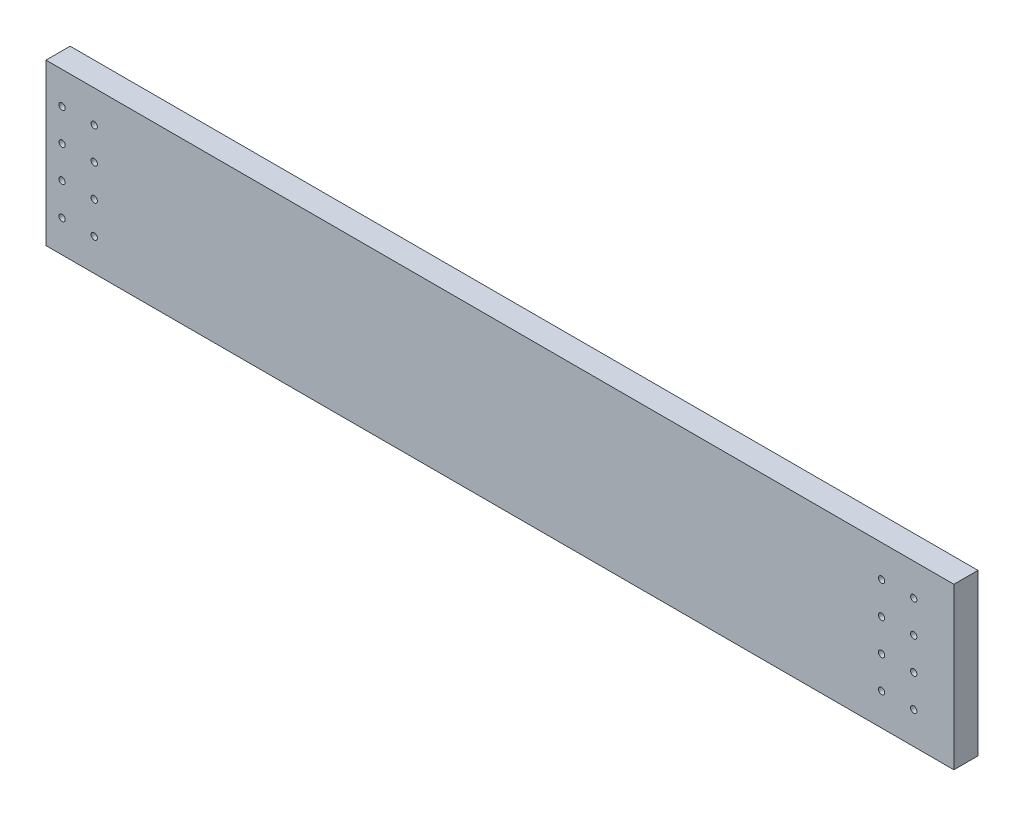
from build123d import *

# Parameters (mm, degrees)
SKETCH1_W           = 717.55
SKETCH1_H           = 127
BOSS_EXTRUDE1_DEPTH = 19.05
SKETCH2_R           = 2.4892
CUT_EXTRUDE1_DEPTH  = 25.4


with BuildPart() as part:
    # Sketch1 → Boss-Extrude1 (new body)
    with BuildSketch(Plane.XY):
        with Locations((358.775, 63.5)):
            Rectangle(SKETCH1_W, SKETCH1_H)
    extrude(amount=BOSS_EXTRUDE1_DEPTH)

    # Sketch2 → Cut-Extrude1 (cut)
    with BuildSketch(Plane.XY.offset(19.05)):
        with Locations((12.7, 101.6)):
            Circle(SKETCH2_R)
        with Locations((38.1, 101.6)):
            Circle(SKETCH2_R)
        with Locations((38.1, 76.2)):
            Circle(SKETCH2_R)
        with Locations((38.1, 50.8)):
            Circle(SKETCH2_R)
        with Locations((38.1, 25.4)):
            Circle(SKETCH2_R)
        with Locations((12.7, 76.2)):
            Circle(SKETCH2_R)
        with Locations((12.7, 50.8)):
            Circle(SKETCH2_R)
        with Locations((12.7, 25.4)):
            Circle(SKETCH2_R)
        with Locations((685.8, 101.6)):
            Circle(SKETCH2_R)
        with Locations((660.4, 101.6)):
            Circle(SKETCH2_R)
        with Locations((660.4, 76.2)):
            Circle(SKETCH2_R)
        with Locations((660.4, 50.8)):
            Circle(SKETCH2_R)
        with Locations((660.4, 25.4)):
            Circle(SKETCH2_R)
        with Locations((685.8, 76.2)):
            Circle(SKETCH2_R)
        with Locations((685.8, 50.8)):
            Circle(SKETCH2_R)
        with Locations((685.8, 25.4)):
            Circle(SKETCH2_R)
    extrude(amount=-CUT_EXTRUDE1_DEPTH, mode=Mode.SUBTRACT)


solid = part.part
